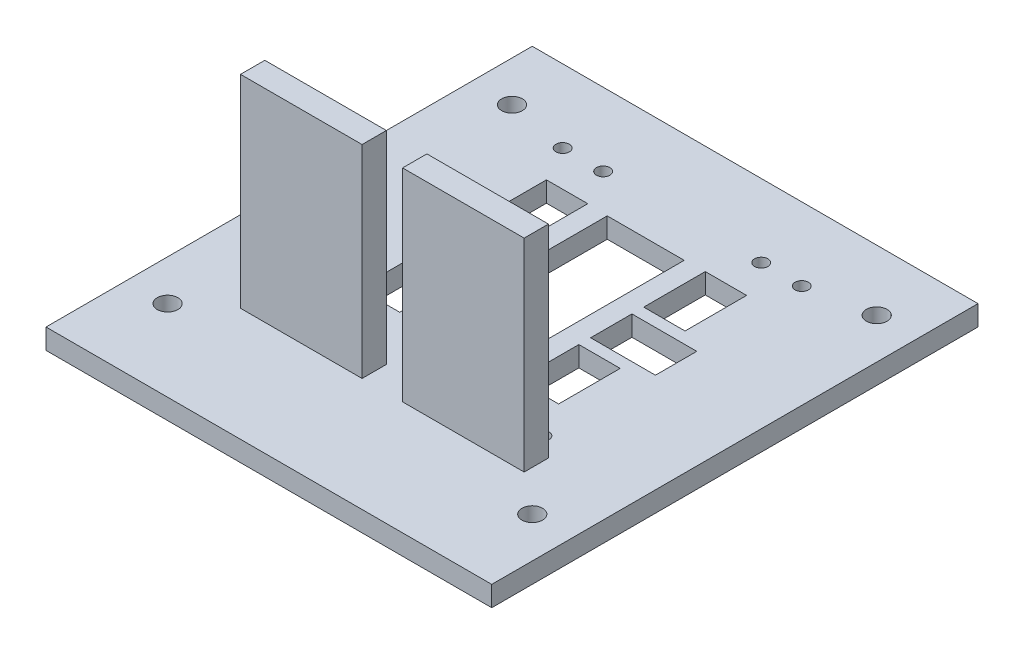
from build123d import *

# Parameters (mm, degrees)
SKETCH1_R           = 1.65
SKETCH1_W           = 19
SKETCH1_H           = 46
BOSS_EXTRUDE3_DEPTH = 5
SKETCH5_R           = 2.55
CUT_EXTRUDE2_DEPTH  = 90.162772501
SKETCH9_W           = 10.2
SKETCH9_H           = 15.2
CUT_EXTRUDE3_DEPTH  = 90.162772501
SKETCH6_W           = 30
SKETCH6_H           = 6
BOSS_EXTRUDE4_DEPTH = 50
SKETCH11_W          = 16
SKETCH11_H          = 10.2
CUT_EXTRUDE4_DEPTH  = 103.102889283


with BuildPart() as part:
    # Sketch1 → Boss-Extrude3 (new body)
    with BuildSketch(Plane(origin=(0, 0, 0), x_dir=(1, 0, 0), z_dir=(0, 1, 0))):
        Polygon((55, 50), (-55, 50), (-55, 31.75), (-55, -31.75), (-55, -70), (-20, -70), (2.5, -70), (20, -70), (42.5, -70), (55, -70), (55, -31.75), (55, 31.75), align=None)
        with Locations((-29.5, -32)):
            Circle(SKETCH1_R, mode=Mode.SUBTRACT)
        with Locations((-19.5, -32)):
            Circle(SKETCH1_R, mode=Mode.SUBTRACT)
        with Locations((19.5, -32)):
            Circle(SKETCH1_R, mode=Mode.SUBTRACT)
        with Locations((29.5, -32)):
            Circle(SKETCH1_R, mode=Mode.SUBTRACT)
        with Locations((-29.5, 32)):
            Circle(SKETCH1_R, mode=Mode.SUBTRACT)
        with Locations((-19.5, 32)):
            Circle(SKETCH1_R, mode=Mode.SUBTRACT)
        Rectangle(SKETCH1_W, SKETCH1_H, mode=Mode.SUBTRACT)
        with Locations((19.5, 32)):
            Circle(SKETCH1_R, mode=Mode.SUBTRACT)
        with Locations((29.5, 32)):
            Circle(SKETCH1_R, mode=Mode.SUBTRACT)
    extrude(amount=BOSS_EXTRUDE3_DEPTH)

    # Sketch5 → Cut-Extrude2 (cut, through all)
    with BuildSketch(Plane.XZ):
        with Locations((-45, 50)):
            Circle(SKETCH5_R)
        with Locations((-45, -35)):
            Circle(SKETCH5_R)
        with Locations((45, -35)):
            Circle(SKETCH5_R)
        with Locations((45, 50)):
            Circle(SKETCH5_R)
    extrude(amount=-CUT_EXTRUDE2_DEPTH, mode=Mode.SUBTRACT)

    # Sketch9 → Cut-Extrude3 (cut, through all)
    with BuildSketch(Plane(origin=(0, 5, 0), x_dir=(1, 0, 0), z_dir=(0, 1, 0))):
        with Locations((-19.6, 15.6)):
            Rectangle(SKETCH9_W, SKETCH9_H)
        with Locations((-19.6, -15.6)):
            Rectangle(SKETCH9_W, SKETCH9_H)
        with Locations((19.6, -15.6)):
            Rectangle(SKETCH9_W, SKETCH9_H)
        with Locations((19.6, 15.6)):
            Rectangle(SKETCH9_W, SKETCH9_H)
    extrude(amount=-CUT_EXTRUDE3_DEPTH, mode=Mode.SUBTRACT)

    # Sketch6 → Boss-Extrude4 (add)
    with BuildSketch(Plane(origin=(0, 5, 0), x_dir=(1, 0, 0), z_dir=(0, 1, 0))):
        with Locations((-20, -39)):
            Rectangle(SKETCH6_W, SKETCH6_H)
        with Locations((20, -39)):
            Rectangle(SKETCH6_W, SKETCH6_H)
    extrude(amount=BOSS_EXTRUDE4_DEPTH)

    # Sketch11 → Cut-Extrude4 (cut, through all)
    with BuildSketch(Plane(origin=(0, 5, 0), x_dir=(1, 0, 0), z_dir=(0, 1, 0))):
        with Locations((22.5, 0)):
            Rectangle(SKETCH11_W, SKETCH11_H)
    extrude(amount=-CUT_EXTRUDE4_DEPTH, mode=Mode.SUBTRACT)


solid = part.part
